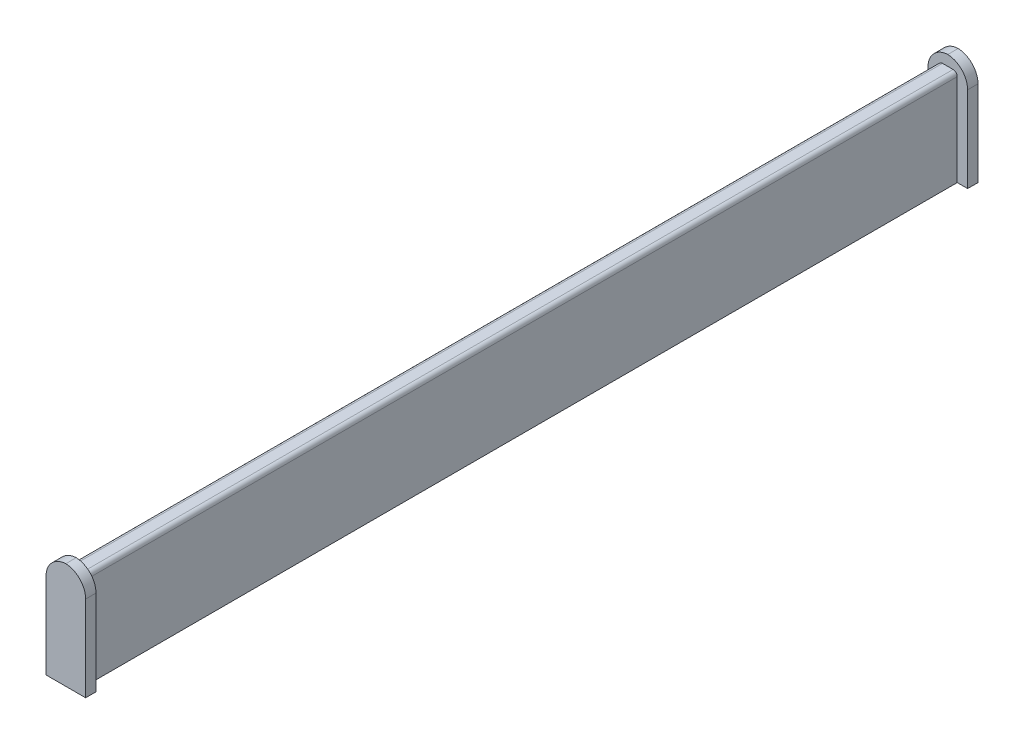
from build123d import *

# Parameters (mm, degrees)
BOSS_EXTRUDE1_DEPTH  = 133.35
SKETCH2_W            = 6.06425
SKETCH2_H            = 5.11175
BOSS_EXTRUDE2_DEPTH  = 1.5875
FILLET1_R            = 3.175
FILLET1_OF_MIRROR1_R = 3.175
FILLET2_R            = 0.635
BOSS_EXTRUDE3_DEPTH  = 11.150000052


with BuildPart() as part:
    # Sketch1 → Boss-Extrude1 (new body)
    with BuildSketch(Plane.XY):
        Polygon((0.142875, 3.667125), (3.032125, 3.667125), (3.032125, 1.905), (3.032125, 0.142875), (0.142875, 0.142875), (0.142875, 1.905), align=None)
    extrude(amount=BOSS_EXTRUDE1_DEPTH)

    # Sketch2 → Boss-Extrude2 (add)
    with BuildSketch(Plane.XY.offset(133.35)):
        with Locations((1.5875, 2.69875)):
            Rectangle(SKETCH2_W, SKETCH2_H)
    boss_extrude2 = extrude(amount=BOSS_EXTRUDE2_DEPTH)

    # Fillet1
    # the kernel refuses this fillet: 3.175 mm, written as the material it takes off along each edge
    with BuildSketch(Plane(origin=(-1.444625, 5.254625, 125.4125), x_dir=(0, -1, 0), z_dir=(0, 0, 1))) as fillet1_piece_1:
        with BuildLine():
            CenterArc((FILLET1_R, FILLET1_R), FILLET1_R, 180, 90)
            Line((0, FILLET1_R), (0, 0))
            Line((0, 0), (FILLET1_R, 0))
        make_face()
    extrude(amount=17.4625, mode=Mode.SUBTRACT)
    with BuildSketch(Plane(origin=(4.619625, 5.254625, 125.4125), x_dir=(0, -1, 0), z_dir=(0, 0, 1))) as fillet1_piece_2:
        with BuildLine():
            CenterArc((FILLET1_R, -FILLET1_R), FILLET1_R, 90, 90)
            Line((0, -FILLET1_R), (0, 0))
            Line((0, 0), (FILLET1_R, 0))
        make_face()
    extrude(amount=17.4625, mode=Mode.SUBTRACT)

    # Mirror1: Boss-Extrude2 across plane
    add(boss_extrude2.mirror(Plane.XY.offset(66.675)))

    # Fillet1 of Mirror1
    # the kernel refuses this fillet: 3.175 mm, written as the material it takes off along each edge
    with BuildSketch(Plane(origin=(-1.444625, 5.254625, 7.9375), x_dir=(0, -1, 0), z_dir=(0, 0, -1))) as fillet1_of_mirror1_piece_1:
        with BuildLine():
            CenterArc((FILLET1_OF_MIRROR1_R, -FILLET1_OF_MIRROR1_R), FILLET1_OF_MIRROR1_R, 90, 90)
            Line((0, -FILLET1_OF_MIRROR1_R), (0, 0))
            Line((0, 0), (FILLET1_OF_MIRROR1_R, 0))
        make_face()
    extrude(amount=17.4625, mode=Mode.SUBTRACT)
    with BuildSketch(Plane(origin=(4.619625, 5.254625, 7.9375), x_dir=(0, -1, 0), z_dir=(0, 0, -1))) as fillet1_of_mirror1_piece_2:
        with BuildLine():
            CenterArc((FILLET1_OF_MIRROR1_R, FILLET1_OF_MIRROR1_R), FILLET1_OF_MIRROR1_R, 180, 90)
            Line((0, FILLET1_OF_MIRROR1_R), (0, 0))
            Line((0, 0), (FILLET1_OF_MIRROR1_R, 0))
        make_face()
    extrude(amount=17.4625, mode=Mode.SUBTRACT)

    # Fillet2
    fillet2_edges = [part.edges().sort_by_distance(p)[0] for p in [
        (3.032125, 3.667125, 66.675),
        (0.142875, 3.667125, 66.675),
    ]]
    fillet(fillet2_edges, radius=FILLET2_R)

    # Sketch3 → Boss-Extrude3 (add)
    with BuildSketch(Plane.XZ.offset(-0.142875)):
        Polygon((-1.444625, 134.9375), (4.619625, 134.9375), (4.619625, 133.35), (3.032125, 133.35), (3.032125, 0), (4.619625, 0), (4.619625, -1.5875), (-1.444625, -1.5875), (-1.444625, 0), (0.142875, 0), (0.142875, 133.35), (-1.444625, 133.35), align=None)
    extrude(amount=BOSS_EXTRUDE3_DEPTH)


solid = part.part
